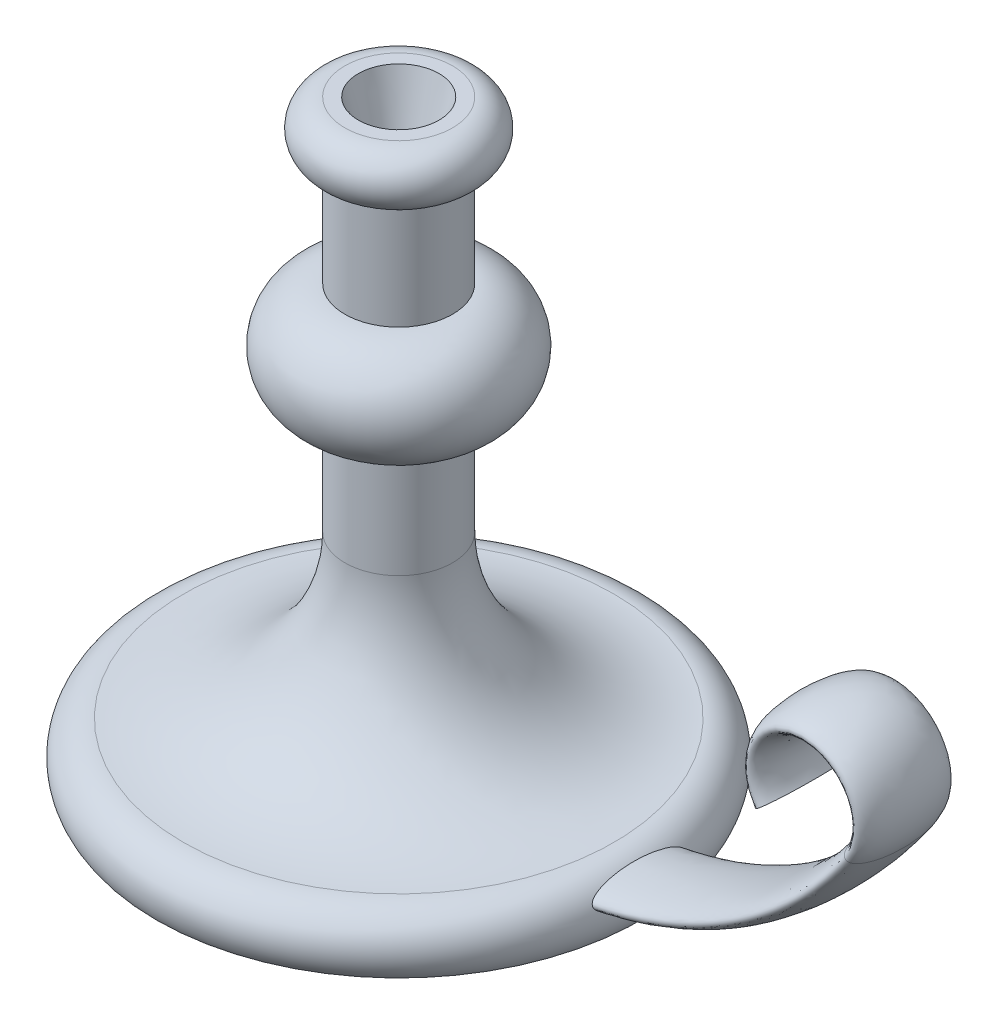
from build123d import *

# Parameters (mm, degrees)
SKETCH3_RX         = 17.5
SKETCH3_RY         = 5
SKETCH4_R          = 15
CUT_EXTRUDE1_DEPTH = 25
CUT_EXTRUDE1_DRAFT = -15


with BuildPart() as part:
    # Sketch1 → Revolve2 (revolve)
    with BuildSketch(Plane.XY):
        with BuildLine():
            Line((0, 220), (0, 0))
            Line((0, 0), (90, 0))
            ThreePointArc((90, 0), (91.180339887, 13.090169944), (80, 20))
            ThreePointArc((80, 20), (37.573593129, 37.573593129), (20, 80))
            Line((20, 80), (20, 120))
            ThreePointArc((20, 120), (40, 140), (20, 160))
            Line((20, 160), (20, 200))
            ThreePointArc((20, 200), (30, 210), (20, 220))
            Line((20, 220), (0, 220))
        make_face()
    revolve(axis=Axis((0, 0, 0), (0, 1, 0)))

    # Sweep1: sweep along a path in Sketch2
    with BuildLine(Plane.XY) as sweep1_path:
        Line((0, 10), (60, 10))
        ThreePointArc((60, 10), (129.821200219, 27.240819526), (183.592070943, 75))
        ThreePointArc((183.592070943, 75), (167.113128151, 106.333333333), (150.634185358, 75))
    # Sketch3 → Sweep1 (sweep)
    with BuildSketch(Plane(origin=(0, 0, 0), x_dir=(0, 0, -1), z_dir=(1, 0, 0))):
        with Locations((0, 10)):
            Ellipse(SKETCH3_RX, SKETCH3_RY)
    sweep(path=sweep1_path.line)


with BuildPart() as cut_extrude1_tool:
    # Sketch4 → Cut-Extrude1 (with draft: the straight prism first)
    with BuildSketch(Plane(origin=(0, 220, 0), x_dir=(1, 0, 0), z_dir=(0, 1, 0))):
        Circle(SKETCH4_R)
    extrude(amount=-CUT_EXTRUDE1_DEPTH)
    # Cut-Extrude1: the draft: its side faces are tilted about the plane it starts from
    cut_extrude1_sides = [cut_extrude1_tool.faces().sort_by_distance(p)[0] for p in [
        (-15, 207.5, 0),
    ]]
    draft(cut_extrude1_sides, Plane(origin=(0, 220, 0), x_dir=(1, 0, 0), z_dir=(0, 1, 0)), CUT_EXTRUDE1_DRAFT)


with BuildPart() as part_1:
    add(part.part)

    # Cut-Extrude1: cut by cut_extrude1_tool
    add(cut_extrude1_tool.part, mode=Mode.SUBTRACT)


solid = part_1.part
